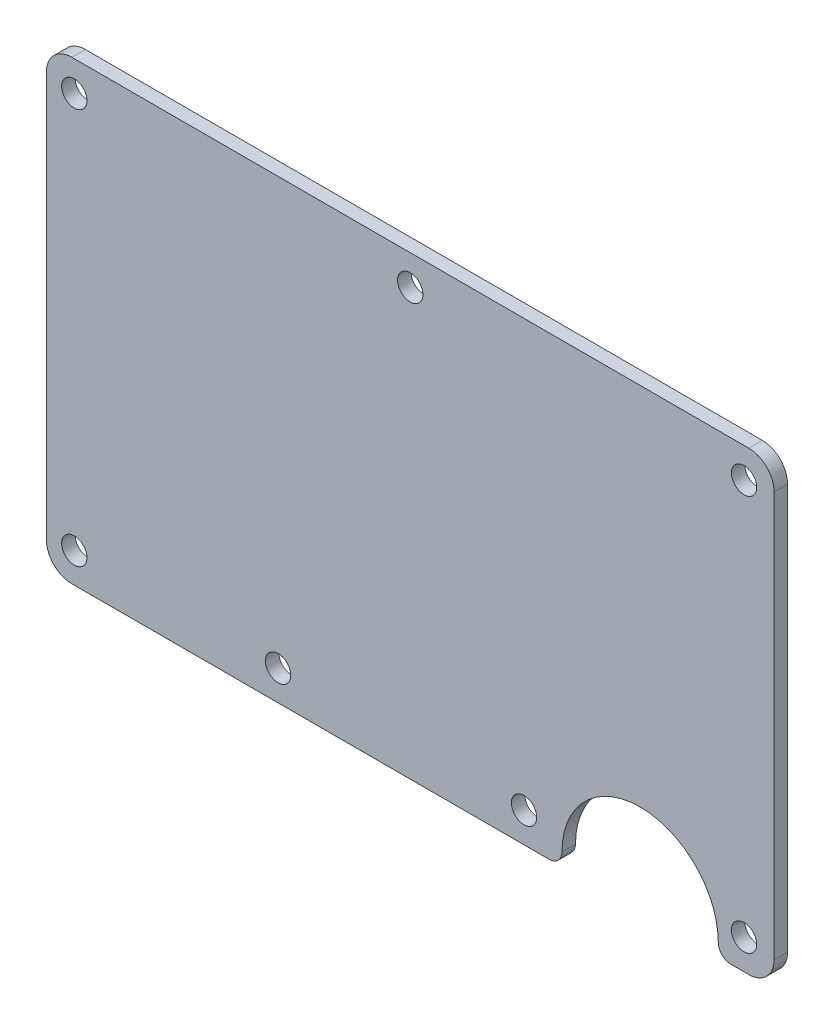
from build123d import *

# Parameters (mm, degrees)
SKETCH1_R           = 1.5
SKETCH1_R_2         = 1.4999995
BOSS_EXTRUDE1_DEPTH = 1.6


with BuildPart() as part:
    # Sketch1 → Boss-Extrude1 (new body)
    with BuildSketch(Plane.XY.offset(1.6)):
        with BuildLine():
            Line((0, 50.9476), (0, 3))
            ThreePointArc((0, 3), (0.878679656, 0.878679656), (3, 0))
            Line((3, 0), (59.5, 0))
            ThreePointArc((59.5, 0), (60.560660172, 0.439339828), (61, 1.5))
            ThreePointArc((61, 1.5), (70.25, 10.75), (79.5, 1.5))
            ThreePointArc((79.5, 1.5), (79.939339828, 0.439339828), (81, 0))
            Line((81, 0), (83.1, 0))
            ThreePointArc((83.1, 0), (85.221320344, 0.878679656), (86.1, 3))
            Line((86.1, 3), (86.1, 50.9476))
            ThreePointArc((86.1, 50.9476), (85.221320344, 53.068920344), (83.1, 53.9476))
            Line((83.1, 53.9476), (3, 53.9476))
            ThreePointArc((3, 53.9476), (0.878679656, 53.068920344), (0, 50.9476))
        make_face()
        with Locations((3.302, 50.3904)):
            Circle(SKETCH1_R, mode=Mode.SUBTRACT)
        with Locations((3.302, 3.556)):
            Circle(SKETCH1_R, mode=Mode.SUBTRACT)
        with Locations((82.55, 3.556)):
            Circle(SKETCH1_R, mode=Mode.SUBTRACT)
        with Locations((82.55, 50.3904)):
            Circle(SKETCH1_R, mode=Mode.SUBTRACT)
        with Locations((27.4096, 3.556)):
            Circle(SKETCH1_R_2, mode=Mode.SUBTRACT)
        with Locations((56.515, 3.556)):
            Circle(SKETCH1_R, mode=Mode.SUBTRACT)
        with Locations((43.05, 50.3904)):
            Circle(SKETCH1_R, mode=Mode.SUBTRACT)
    extrude(amount=-BOSS_EXTRUDE1_DEPTH)


solid = part.part
